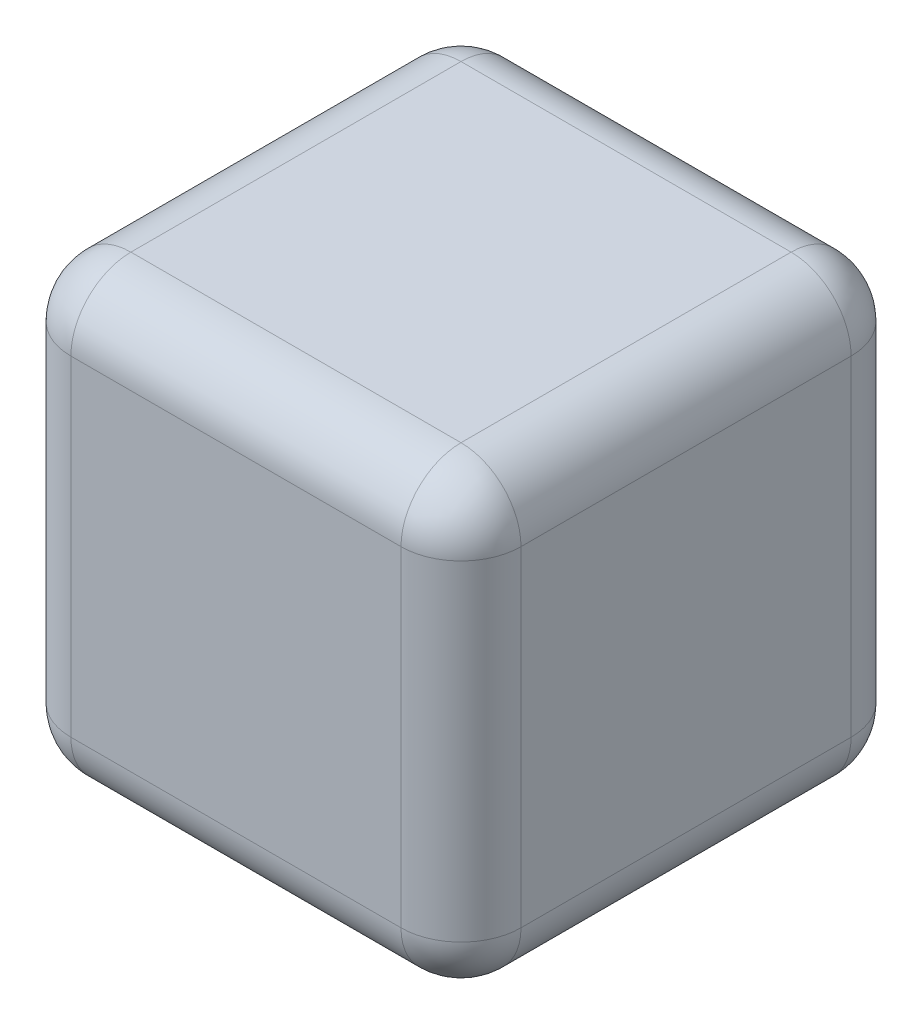
from build123d import *

# Parameters (mm, degrees)
SKETCH1_W           = 150
SKETCH1_H           = 150
BOSS_EXTRUDE1_DEPTH = 150
FILLET1_R           = 20
SHELL1_T            = 1.5


with BuildPart() as part:
    # Sketch1 → Boss-Extrude1 (new body)
    with BuildSketch(Plane(origin=(0, 0, 0), x_dir=(1, 0, 0), z_dir=(0, 1, 0))):
        Rectangle(SKETCH1_W, SKETCH1_H)
    extrude(amount=BOSS_EXTRUDE1_DEPTH)

    # Fillet1
    fillet1_edges = [part.edges().sort_by_distance(p)[0] for p in [
        (0, 0, -75),
        (75, 75, -75),
        (75, 0, 0),
        (-75, 75, -75),
        (-75, 0, 0),
        (-75, 75, 75),
        (75, 75, 75),
        (0, 0, 75),
        (0, 150, -75),
        (75, 150, 0),
        (0, 150, 75),
        (-75, 150, 0),
    ]]
    fillet(fillet1_edges, radius=FILLET1_R)

    # Shell1 (no face opened: a closed hollow body)
    add(offset(amount=-SHELL1_T, mode=Mode.PRIVATE), mode=Mode.SUBTRACT)


solid = part.part
